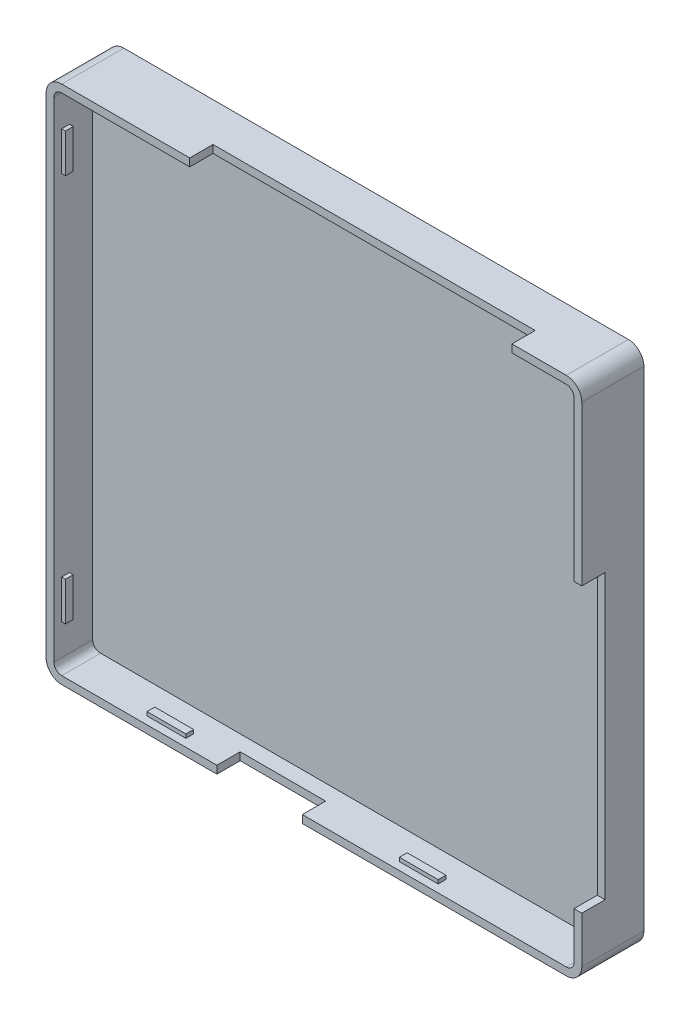
from build123d import *

# Parameters (mm, degrees)
BOSS_EXTRU_1_DEPTH      = 8
ENL_V_MAT_EXTRU_1_DEPTH = 5
ESQUISSE4_W             = 5
ESQUISSE4_H             = 1
BOSS_EXTRU_3_DEPTH      = 0.48904
ESQUISSE5_W             = 1
ESQUISSE5_H             = 5
BOSS_EXTRU_4_DEPTH      = 0.48904
ESQUISSE6_W             = 1
ESQUISSE6_H             = 5
BOSS_EXTRU_5_DEPTH      = 0.48904
ESQUISSE7_W             = 1
ESQUISSE7_H             = 5
BOSS_EXTRU_6_DEPTH      = 0.48904
ESQUISSE8_W             = 5
ESQUISSE8_H             = 1
BOSS_EXTRU_7_DEPTH      = 0.48904
ESQUISSE9_W             = 5
ESQUISSE9_H             = 1
BOSS_EXTRU_8_DEPTH      = 0.48904
ESQUISSE10_W            = 3
ESQUISSE10_H            = 36.5
ENL_V_MAT_EXTRU_3_DEPTH = 96.796659649
ESQUISSE11_W            = 41.5
ESQUISSE11_H            = 3
ENL_V_MAT_EXTRU_4_DEPTH = 96.81753493
ESQUISSE12_W            = 11
ESQUISSE12_H            = 3
ENL_V_MAT_EXTRU_5_DEPTH = 96.81753493


with BuildPart() as part:
    # Esquisse1 → Boss.-Extru.1 (new body)
    with BuildSketch(Plane.XY):
        with BuildLine():
            Line((2, 0), (67, 0))
            ThreePointArc((67, 0), (68.414213562, 0.585786438), (69, 2))
            Line((69, 2), (69, 65))
            ThreePointArc((69, 65), (68.414213562, 66.414213562), (67, 67))
            Line((67, 67), (2, 67))
            ThreePointArc((2, 67), (0.585786438, 66.414213562), (0, 65))
            Line((0, 65), (0, 2))
            ThreePointArc((0, 2), (0.585786438, 0.585786438), (2, 0))
        make_face()
    extrude(amount=BOSS_EXTRU_1_DEPTH)

    # Esquisse3 → Enlèv. mat.-Extru.1 (cut)
    with BuildSketch(Plane.XY.offset(8)):
        with BuildLine():
            Line((2, 1), (67, 1))
            ThreePointArc((67, 1), (67.707106781, 1.292893219), (68, 2))
            Line((68, 2), (68, 65))
            ThreePointArc((68, 65), (67.707106781, 65.707106781), (67, 66))
            Line((67, 66), (2, 66))
            ThreePointArc((2, 66), (1.292893219, 65.707106781), (1, 65))
            Line((1, 65), (1, 2))
            ThreePointArc((1, 2), (1.292893219, 1.292893219), (2, 1))
        make_face()
    extrude(amount=-ENL_V_MAT_EXTRU_1_DEPTH, mode=Mode.SUBTRACT)

    # Esquisse4 → Boss.-Extru.3 (add)
    with BuildSketch(Plane.XZ.offset(-66)):
        with Locations((10.679731729, 6.5)):
            Rectangle(ESQUISSE4_W, ESQUISSE4_H)
    extrude(amount=BOSS_EXTRU_3_DEPTH)

    # Esquisse5 → Boss.-Extru.4 (add)
    with BuildSketch(Plane.ZY.offset(-68)):
        with Locations((6.5, 59.5)):
            Rectangle(ESQUISSE5_W, ESQUISSE5_H)
    extrude(amount=BOSS_EXTRU_4_DEPTH)

    # Esquisse6 → Boss.-Extru.5 (add)
    with BuildSketch(Plane(origin=(1, 0, 0), x_dir=(0, 0, -1), z_dir=(1, 0, 0))):
        with Locations((-6.5, 58.5)):
            Rectangle(ESQUISSE6_W, ESQUISSE6_H)
    extrude(amount=BOSS_EXTRU_5_DEPTH)

    # Esquisse7 → Boss.-Extru.6 (add)
    with BuildSketch(Plane(origin=(1, 0, 0), x_dir=(0, 0, -1), z_dir=(1, 0, 0))):
        with Locations((-6.5, 8.5)):
            Rectangle(ESQUISSE7_W, ESQUISSE7_H)
    extrude(amount=BOSS_EXTRU_6_DEPTH)

    # Esquisse8 → Boss.-Extru.7 (add)
    with BuildSketch(Plane(origin=(0, 1, 0), x_dir=(1, 0, 0), z_dir=(0, 1, 0))):
        with Locations((14.5, -6.5)):
            Rectangle(ESQUISSE8_W, ESQUISSE8_H)
    extrude(amount=BOSS_EXTRU_7_DEPTH)

    # Esquisse9 → Boss.-Extru.8 (add)
    with BuildSketch(Plane(origin=(0, 1, 0), x_dir=(1, 0, 0), z_dir=(0, 1, 0))):
        with Locations((47, -6.5)):
            Rectangle(ESQUISSE9_W, ESQUISSE9_H)
    extrude(amount=BOSS_EXTRU_8_DEPTH)

    # Esquisse10 → Enlèv. mat.-Extru.3 (cut, through all)
    with BuildSketch(Plane.ZY.offset(-68)):
        with Locations((6.5, 26.25)):
            Rectangle(ESQUISSE10_W, ESQUISSE10_H)
    extrude(amount=-ENL_V_MAT_EXTRU_3_DEPTH, mode=Mode.SUBTRACT)

    # Esquisse11 → Enlèv. mat.-Extru.4 (cut, through all)
    with BuildSketch(Plane.XZ.offset(-66)):
        with Locations((39.25, 6.5)):
            Rectangle(ESQUISSE11_W, ESQUISSE11_H)
    extrude(amount=-ENL_V_MAT_EXTRU_4_DEPTH, mode=Mode.SUBTRACT)

    # Esquisse12 → Enlèv. mat.-Extru.5 (cut, through all)
    with BuildSketch(Plane(origin=(0, 1, 0), x_dir=(1, 0, 0), z_dir=(0, 1, 0))):
        with Locations((27.5, -6.5)):
            Rectangle(ESQUISSE12_W, ESQUISSE12_H)
    extrude(amount=-ENL_V_MAT_EXTRU_5_DEPTH, mode=Mode.SUBTRACT)


solid = part.part
